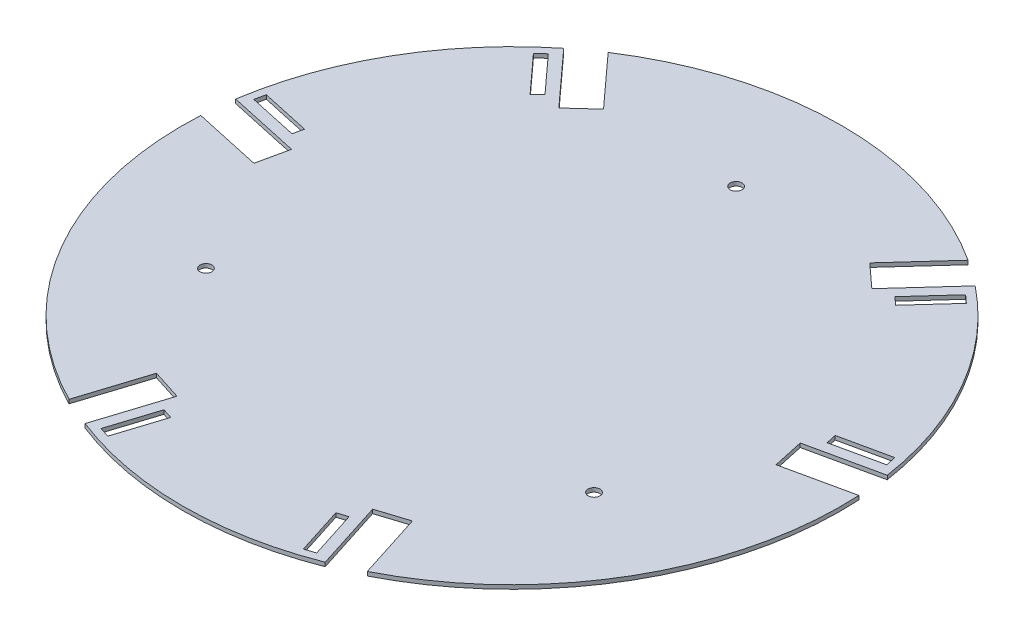
from build123d import *

# Parameters (mm, degrees)
SKETCH2_R           = 125
BOSS_EXTRUDE1_DEPTH = 1.5
SKETCH3_W           = 3
SKETCH3_H           = 19
CUT_EXTRUDE1_DEPTH  = 177.783059143
SKETCH4_R           = 2.25
CUT_EXTRUDE2_DEPTH  = 177.783059143
CUT_EXTRUDE5_DEPTH  = 177.783059143
CIRPATTERN2_COUNT   = 3


with BuildPart() as part:
    # Sketch2 → Boss-Extrude1 (new body)
    with BuildSketch(Plane(origin=(0, 0, 0), x_dir=(1, 0, 0), z_dir=(0, 1, 0))):
        Circle(SKETCH2_R)
    extrude(amount=BOSS_EXTRUDE1_DEPTH)

    # Sketch3 → Cut-Extrude1 (cut, through all)
    with BuildSketch(Plane(origin=(0, 1.5, 0), x_dir=(1, 0, 0), z_dir=(0, 1, 0))):
        with Locations((-268.691654721, -368.173324402)):
            Rectangle(SKETCH3_W, SKETCH3_H)
        Polygon((31.312, -98.125219266), (35.122688127, -96.909219266), (40.898688127, -115.009987868), (37.088, -116.225987868), align=None)
        Polygon((-37.088, -116.225987868), (-31.312, -98.125219266), (-35.122688127, -96.909219266), (-40.898688127, -115.009987868), align=None)
        Polygon((-82.110658074, 90.23214411), (-69.322932636, 76.179597076), (-66.364501682, 78.8717498), (-79.15222712, 92.924296834), align=None)
        Polygon((-100.634932636, 21.94562219), (-101.487189809, 18.037469466), (-120.050915246, 22.085691035), (-119.198658074, 25.993843759), align=None)
        Polygon((119.198658074, 25.993843759), (100.634932636, 21.94562219), (101.487189809, 18.037469466), (120.050915246, 22.085691035), align=None)
        Polygon((69.322932636, 76.179597076), (66.364501682, 78.8717498), (79.15222712, 92.924296834), (82.110658074, 90.23214411), align=None)
    extrude(amount=-CUT_EXTRUDE1_DEPTH, mode=Mode.SUBTRACT)

    # Sketch4 → Cut-Extrude2 (cut, through all)
    with BuildSketch(Plane(origin=(0, 1.5, 0), x_dir=(1, 0, 0), z_dir=(0, 1, 0))):
        with Locations((0, 85)):
            Circle(SKETCH4_R)
        with Locations((73.612159322, -42.5)):
            Circle(SKETCH4_R)
        with Locations((-73.612159322, -42.5)):
            Circle(SKETCH4_R)
    extrude(amount=-CUT_EXTRUDE2_DEPTH, mode=Mode.SUBTRACT)

    # Sketch6 → Cut-Extrude5 (cut, through all)
    with BuildSketch(Plane(origin=(0, 1.5, 0), x_dir=(1, 0, 0), z_dir=(0, 1, 0))):
        Polygon((-55.992533724, -149.153029157), (-67.424598105, -145.505029157), (-48.541440634, -86.329187076), (-37.109376254, -89.977187076), align=None)
        Polygon((67.424598105, -145.505029157), (48.541440634, -86.329187076), (37.109376254, -89.977187076), (55.992533724, -149.153029157), align=None)
    cut_extrude5 = extrude(amount=-CUT_EXTRUDE5_DEPTH, mode=Mode.SUBTRACT)

    # CirPattern2: Cut-Extrude5 ×3 about axis
    cirpattern2_axis = Axis((0, 1.5, 0), (0, 1, 0))
    for i in range(1, CIRPATTERN2_COUNT):
        add(cut_extrude5.rotate(cirpattern2_axis, i * 360 / CIRPATTERN2_COUNT), mode=Mode.SUBTRACT)


solid = part.part
